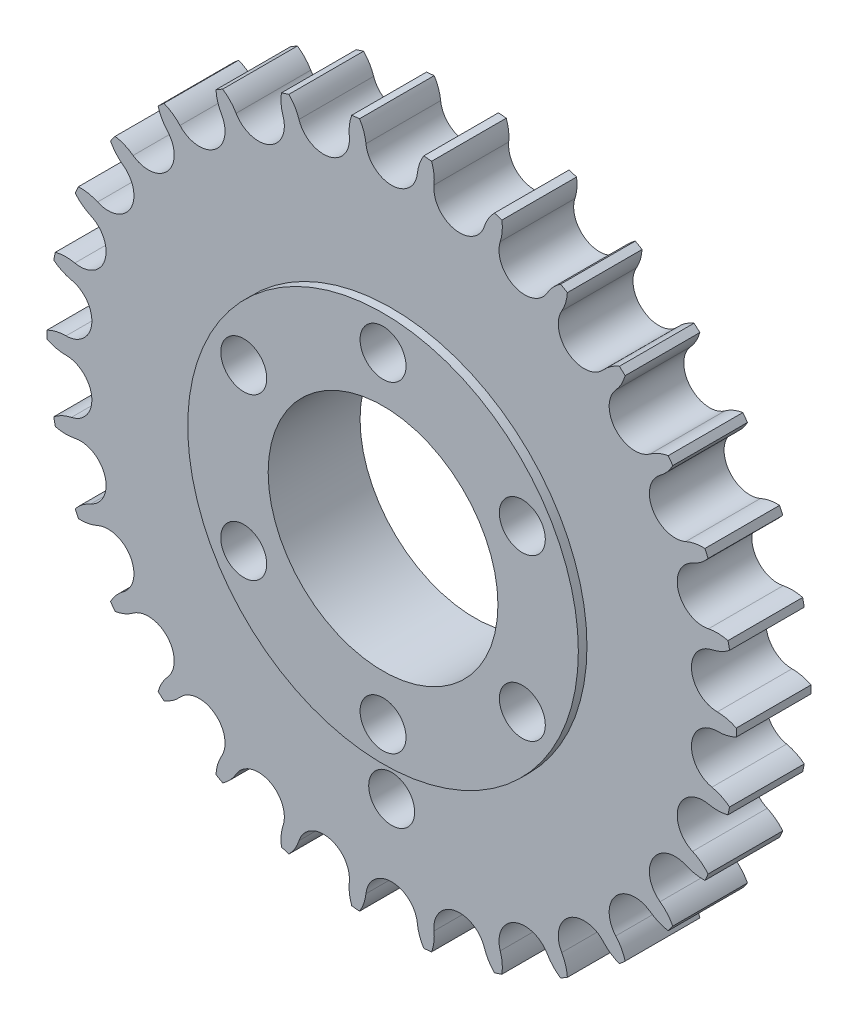
from build123d import *

# Parameters (mm, degrees)
SKETCH2_R           = 30
SKETCH2_R_2         = 10
BOSS_EXTRUDE1_DEPTH = 4
SKETCH3_OUTSIDE_W   = 79.046
SKETCH3_OUTSIDE_H   = 79.046
SKETCH3_OUTSIDE_R   = 17
CUT_EXTRUDE1_DEPTH  = 0.75
SKETCH4_R           = 30
SKETCH4_R_2         = 17
CUT_EXTRUDE2_DEPTH  = 0.75
CUT_EXTRUDE3_DEPTH  = 5
CIRPATTERN1_COUNT   = 30
SKETCH6_R           = 2
CUT_EXTRUDE4_DEPTH  = 5
SKETCH7_R           = 23
SKETCH7_R_2         = 17
CUT_EXTRUDE5_DEPTH  = 0.5
SKETCH8_R           = 2
CUT_EXTRUDE6_DEPTH  = 10


with BuildPart() as part:
    # Sketch2 → Boss-Extrude1 (new, symmetric)
    with BuildSketch(Plane.XY):
        Circle(SKETCH2_R)
        Circle(SKETCH2_R_2, mode=Mode.SUBTRACT)
    extrude(amount=BOSS_EXTRUDE1_DEPTH, both=True)

    # Sketch3 outside → Cut-Extrude1 (cut, symmetric)
    with BuildSketch(Plane.XY.offset(4)):
        Rectangle(SKETCH3_OUTSIDE_W, SKETCH3_OUTSIDE_H)
        Circle(SKETCH3_OUTSIDE_R, mode=Mode.SUBTRACT)
    extrude(amount=CUT_EXTRUDE1_DEPTH, both=True, mode=Mode.SUBTRACT)

    # Sketch4 → Cut-Extrude2 (cut, symmetric)
    with BuildSketch(Plane(origin=(0, 0, -4), x_dir=(-1, 0, 0), z_dir=(0, 0, -1))):
        Circle(SKETCH4_R)
        Circle(SKETCH4_R_2, mode=Mode.SUBTRACT)
    extrude(amount=CUT_EXTRUDE2_DEPTH, both=True, mode=Mode.SUBTRACT)

    # Sketch5 → Cut-Extrude3 (cut, symmetric)
    with BuildSketch(Plane.XY):
        with BuildLine():
            ThreePointArc((2.23767427, 28.264811009), (2.545158064, 29.401533959), (3.193542858, 30.384530655))
            ThreePointArc((3.193542858, 30.384530655), (0, 32.208122406), (-3.193542858, 30.384530655))
            ThreePointArc((-3.193542858, 30.384530655), (-2.54515805, 29.401533927), (-2.237674263, 28.264810941))
            ThreePointArc((-2.237674263, 28.264810941), (3.4e-08, 26.25), (2.23767427, 28.264811009))
        make_face()
    cut_extrude3 = extrude(amount=CUT_EXTRUDE3_DEPTH, both=True, mode=Mode.SUBTRACT)

    # CirPattern1: Cut-Extrude3 ×30 about axis
    cirpattern1_axis = Axis((0, 0, -4), (0, 0, 1))
    for i in range(1, CIRPATTERN1_COUNT):
        add(cut_extrude3.rotate(cirpattern1_axis, i * 360 / CIRPATTERN1_COUNT), mode=Mode.SUBTRACT)

    # Sketch6 → Cut-Extrude4 (cut, symmetric)
    with BuildSketch(Plane.XY):
        with Locations((0, 14)):
            Circle(SKETCH6_R)
        with Locations((12.124355653, 7)):
            Circle(SKETCH6_R)
        with Locations((12.124355653, -7)):
            Circle(SKETCH6_R)
        with Locations((0, -14)):
            Circle(SKETCH6_R)
        with Locations((-12.124355653, -7)):
            Circle(SKETCH6_R)
        with Locations((-12.124355653, 7)):
            Circle(SKETCH6_R)
    extrude(amount=CUT_EXTRUDE4_DEPTH, both=True, mode=Mode.SUBTRACT)

    # Sketch7 → Cut-Extrude5 (cut, symmetric)
    with BuildSketch(Plane(origin=(0, 0, -3.25), x_dir=(-1, 0, 0), z_dir=(0, 0, -1))):
        Circle(SKETCH7_R)
        Circle(SKETCH7_R_2, mode=Mode.SUBTRACT)
    extrude(amount=CUT_EXTRUDE5_DEPTH, both=True, mode=Mode.SUBTRACT)

    # Sketch8 → Cut-Extrude6 (cut)
    with BuildSketch(Plane(origin=(0, 0, -2.75), x_dir=(-1, 0, 0), z_dir=(0, 0, -1))):
        with Locations((0, -20)):
            Circle(SKETCH8_R)
    extrude(amount=-CUT_EXTRUDE6_DEPTH, mode=Mode.SUBTRACT)


solid = part.part
